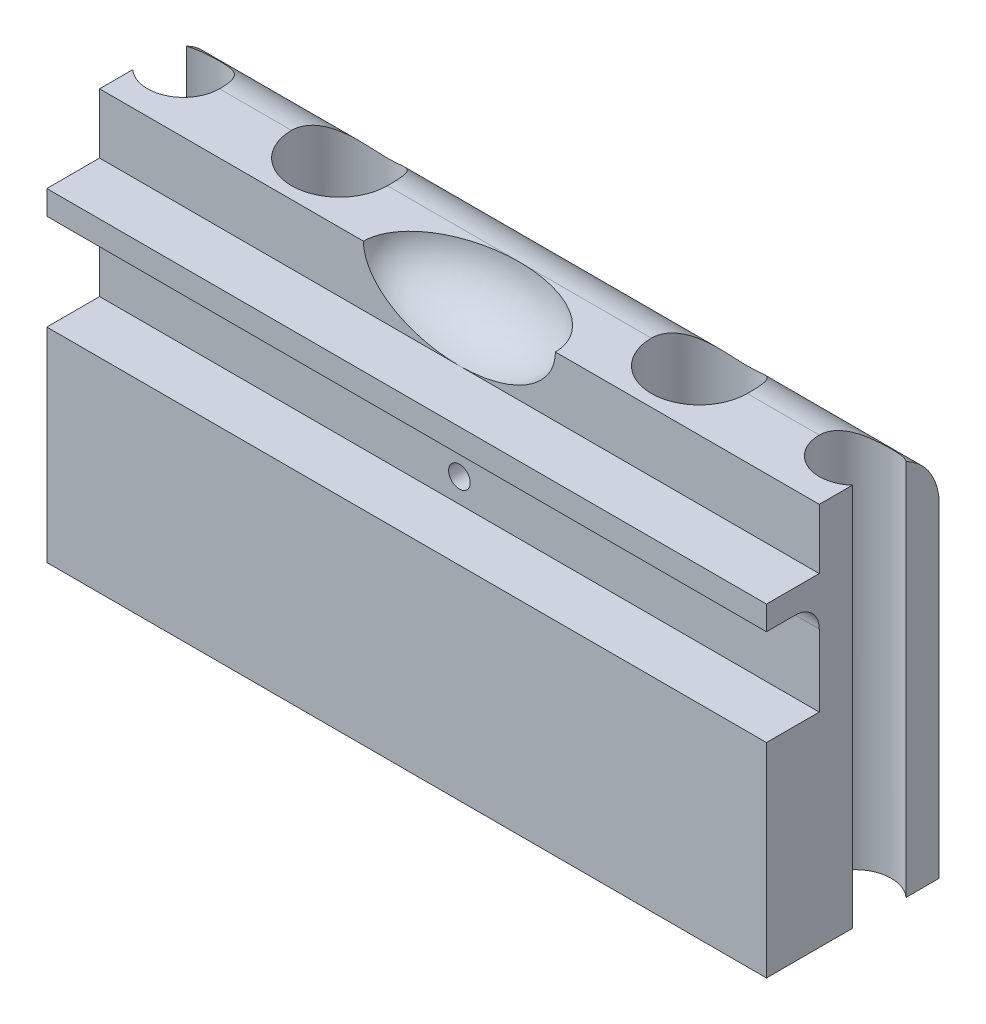
from build123d import *

# Parameters (mm, degrees)
SKETCH2_W           = 18.288
SKETCH2_H           = 40.64
BOSS_EXTRUDE1_DEPTH = 76.2
CUT_EXTRUDE1_REACH  = 90.275
SKETCH3_W           = 5.588
SKETCH3_H           = 6.35
SKETCH3_H_2         = 10.16
CUT_EXTRUDE2_REACH  = 89.289
SKETCH4_R           = 1.143
CUT_EXTRUDE3_REACH  = 90.275
SKETCH5_R           = 2.032
SKETCH6_R           = 5.08
CUT_EXTRUDE4_DEPTH  = 15.24
FILLET1_R           = 6.35
FILLET2_R           = 2.54
SKETCH7_R           = 3.81
CUT_EXTRUDE5_DEPTH  = 89.275141297


with BuildPart() as part:
    # Sketch2 → Boss-Extrude1 (new body)
    with BuildSketch(Plane(origin=(0, 0, 0), x_dir=(0, 0, -1), z_dir=(1, 0, 0))):
        with Locations((9.144, 20.32)):
            Rectangle(SKETCH2_W, SKETCH2_H)
    extrude(amount=BOSS_EXTRUDE1_DEPTH)

    # Sketch3 → Cut-Extrude1 (cut, up to next)
    with BuildSketch(Plane.ZY, mode=Mode.PRIVATE) as cut_extrude1_sk1:
        with Locations((-2.794, 37.465)):
            Rectangle(SKETCH3_W, SKETCH3_H)
    cut_extrude1_tool1 = extrude(cut_extrude1_sk1.sketch, amount=-CUT_EXTRUDE1_REACH, mode=Mode.PRIVATE) & part.part
    # Sketch3 → Cut-Extrude1 (cut, up to next)
    with BuildSketch(Plane.ZY, mode=Mode.PRIVATE) as cut_extrude1_sk2:
        with Locations((-2.794, 26.67)):
            Rectangle(SKETCH3_W, SKETCH3_H_2)
    cut_extrude1_tool2 = extrude(cut_extrude1_sk2.sketch, amount=-CUT_EXTRUDE1_REACH, mode=Mode.PRIVATE) & part.part
    add(cut_extrude1_tool1.solids().sort_by_distance((0, 37.465, -2.794))[0], mode=Mode.SUBTRACT)
    add(cut_extrude1_tool2.solids().sort_by_distance((0, 26.67, -2.794))[0], mode=Mode.SUBTRACT)

    # Sketch4 → Cut-Extrude2 (cut, up to next)
    with BuildSketch(Plane.XY.offset(-5.588), mode=Mode.PRIVATE) as cut_extrude2_sk1:
        with Locations((38.1, 24.13)):
            Circle(SKETCH4_R)
    cut_extrude2_tool1 = extrude(cut_extrude2_sk1.sketch, amount=-CUT_EXTRUDE2_REACH, mode=Mode.PRIVATE) & part.part
    add(cut_extrude2_tool1.solids().sort_by_distance((38.1, 24.13, -5.588))[0], mode=Mode.SUBTRACT)

    # Sketch5 → Cut-Extrude3 (cut, up to next)
    with BuildSketch(Plane(origin=(0, 40.64, 0), x_dir=(1, 0, 0), z_dir=(0, 1, 0)), mode=Mode.PRIVATE) as cut_extrude3_sk1:
        with Locations(Location((57.15, 11.938, 0), (0, 0, 270))):
            Circle(SKETCH5_R)
    cut_extrude3_tool1 = extrude(cut_extrude3_sk1.sketch, amount=-CUT_EXTRUDE3_REACH, mode=Mode.PRIVATE) & part.part
    # Sketch5 → Cut-Extrude3 (cut, up to next)
    with BuildSketch(Plane(origin=(0, 40.64, 0), x_dir=(1, 0, 0), z_dir=(0, 1, 0)), mode=Mode.PRIVATE) as cut_extrude3_sk2:
        with Locations(Location((19.05, 11.938, 0), (0, 0, 270))):
            Circle(SKETCH5_R)
    cut_extrude3_tool2 = extrude(cut_extrude3_sk2.sketch, amount=-CUT_EXTRUDE3_REACH, mode=Mode.PRIVATE) & part.part
    add(cut_extrude3_tool1.solids().sort_by_distance((57.15, 40.64, -11.938))[0], mode=Mode.SUBTRACT)
    add(cut_extrude3_tool2.solids().sort_by_distance((19.05, 40.64, -11.938))[0], mode=Mode.SUBTRACT)

    # Sketch6 → Cut-Extrude4 (cut)
    with BuildSketch(Plane(origin=(0, 40.64, 0), x_dir=(1, 0, 0), z_dir=(0, 1, 0))):
        with Locations(Location((19.05, 11.938, 0), (0, 0, 270))):
            Circle(SKETCH6_R)
        with Locations(Location((57.15, 11.938, 0), (0, 0, 270))):
            Circle(SKETCH6_R)
    extrude(amount=-CUT_EXTRUDE4_DEPTH, mode=Mode.SUBTRACT)

    # Fillet1
    # the kernel refuses this fillet: 6.35 mm, written as the material it takes off along each edge
    with BuildSketch(Plane(origin=(-15.875, 40.64, -18.288), x_dir=(0, -1, 0), z_dir=(1, 0, 0))) as fillet1_piece_1:
        with BuildLine():
            CenterArc((FILLET1_R, -FILLET1_R), FILLET1_R, 90, 90)
            Line((0, -FILLET1_R), (0, 0))
            Line((0, 0), (FILLET1_R, 0))
        make_face()
    extrude(amount=107.95, mode=Mode.SUBTRACT)

    # Fillet2
    fillet2_edges = [part.edges().sort_by_distance(p)[0] for p in [
        (38.1, 31.75, -5.588),
    ]]
    fillet(fillet2_edges, radius=FILLET2_R)

    # Sketch7 → Cut-Extrude5 (cut, through all)
    with BuildSketch(Plane.XZ):
        with Locations((2.54, -11.938)):
            Circle(SKETCH7_R)
        with Locations((73.66, -11.938)):
            Circle(SKETCH7_R)
    extrude(amount=-CUT_EXTRUDE5_DEPTH, mode=Mode.SUBTRACT)

    # Sketch8 → Cut-Revolve3 (revolve, cut)
    with BuildSketch(Plane.XY.offset(-5.588)):
        with BuildLine():
            Line((27.94, 40.64), (48.26, 40.64))
            add(Edge.make_bspline(
                [(27.94, 40.64), (27.94, 34.29), (38.1, 34.29), (48.26, 34.29), (48.26, 40.64)],
                knots=[0, 0, 0, 1.570796327, 1.570796327, 3.141592654, 3.141592654, 3.141592654], degree=2, weights=[1, 0.707106781, 1, 0.707106781, 1]))
        make_face()
    revolve(axis=Axis((76.201, 40.64, -5.588), (-1, 0, 0)), mode=Mode.SUBTRACT)


solid = part.part
